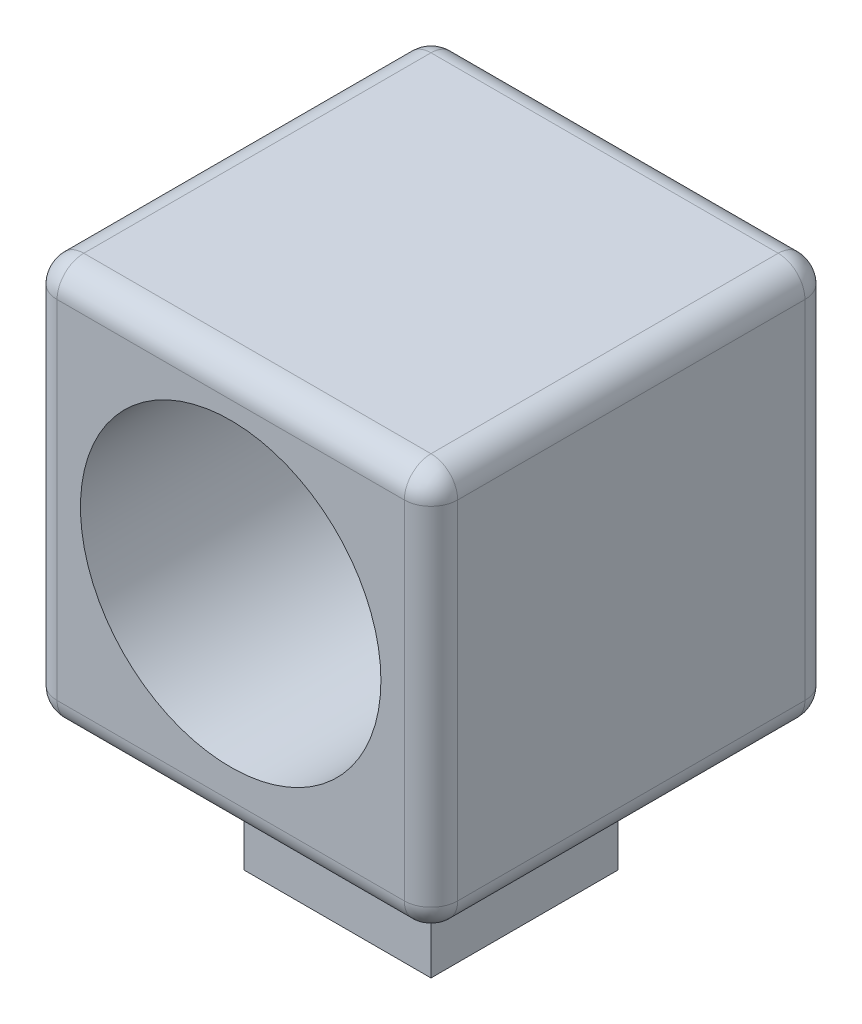
from build123d import *

# Parameters (mm, degrees)
SKETCH1_W           = 17.78
SKETCH1_H           = 17.78
BOSS_EXTRUDE1_DEPTH = 12.7
SKETCH2_W           = 38.1
SKETCH2_H           = 38.1
BOSS_EXTRUDE2_DEPTH = 38.1
SKETCH3_R           = 14.2875
CUT_EXTRUDE1_DEPTH  = 38.1
FILLET1_R           = 2.54


with BuildPart() as part:
    # Sketch1 → Boss-Extrude1 (new body)
    with BuildSketch(Plane(origin=(0, 0, 0), x_dir=(1, 0, 0), z_dir=(0, 1, 0))):
        Rectangle(SKETCH1_W, SKETCH1_H)
    extrude(amount=BOSS_EXTRUDE1_DEPTH)

    # Sketch2 → Boss-Extrude2 (add)
    with BuildSketch(Plane(origin=(0, 12.7, 0), x_dir=(1, 0, 0), z_dir=(0, 1, 0))):
        Rectangle(SKETCH2_W, SKETCH2_H)
    extrude(amount=BOSS_EXTRUDE2_DEPTH)

    # Sketch3 → Cut-Extrude1 (cut)
    with BuildSketch(Plane.XY.offset(19.05)):
        with Locations((0, 32.284247531)):
            Circle(SKETCH3_R)
    extrude(amount=-CUT_EXTRUDE1_DEPTH, mode=Mode.SUBTRACT)

    # Fillet1
    fillet1_edges = [part.edges().sort_by_distance(p)[0] for p in [
        (19.05, 50.8, 0),
        (19.05, 12.7, 0),
        (-19.05, 50.8, 0),
        (-19.05, 12.7, 0),
        (19.05, 31.75, -19.05),
        (0, 50.8, -19.05),
        (-19.05, 31.75, -19.05),
        (0, 12.7, -19.05),
        (-19.05, 31.75, 19.05),
        (0, 50.8, 19.05),
        (19.05, 31.75, 19.05),
        (0, 12.7, 19.05),
    ]]
    fillet(fillet1_edges, radius=FILLET1_R)


solid = part.part
